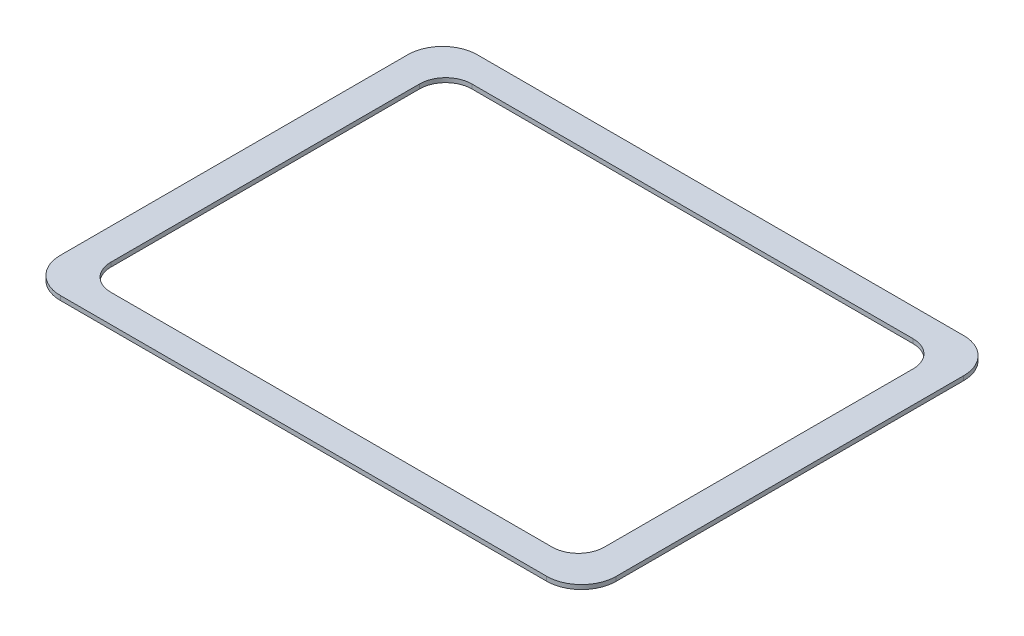
from build123d import *

# Parameters (mm, degrees)
MAINBODY_DEPTH = 1.5875


with BuildPart() as part:
    # Sketch2 → MainBody (new body)
    with BuildSketch(Plane(origin=(0, 49.034568419, 0), x_dir=(1, 0, 0), z_dir=(0, 1, 0))):
        with BuildLine():
            Line((74.712473168, 99.346627483), (-103.087526832, 99.346627483))
            ThreePointArc((-103.087526832, 99.346627483), (-112.067782953, 95.626883604), (-115.787526832, 86.646627483))
            Line((-115.787526832, 86.646627483), (-115.787526832, -40.353372517))
            ThreePointArc((-115.787526832, -40.353372517), (-112.067782953, -49.333628639), (-103.087526832, -53.053372517))
            Line((-103.087526832, -53.053372517), (74.712473168, -53.053372517))
            ThreePointArc((74.712473168, -53.053372517), (83.692729289, -49.333628639), (87.412473168, -40.353372517))
            Line((87.412473168, -40.353372517), (87.412473168, 86.646627483))
            ThreePointArc((87.412473168, 86.646627483), (83.692729289, 95.626883604), (74.712473168, 99.346627483))
        make_face()
        with BuildLine():
            Line((76.007526562, -33.292172517), (76.007526562, 79.585427483))
            ThreePointArc((76.007526562, 79.585427483), (73.218090627, 86.319721548), (66.483796562, 89.109157483))
            Line((66.483796562, 89.109157483), (-94.858850226, 89.109157483))
            ThreePointArc((-94.858850226, 89.109157483), (-101.593144292, 86.319721548), (-104.382580226, 79.585427483))
            Line((-104.382580226, 79.585427483), (-104.382580226, 23.146627483))
            Line((-104.382580226, 23.146627483), (-104.382580226, -33.292172517))
            ThreePointArc((-104.382580226, -33.292172517), (-101.593144292, -40.026466583), (-94.858850226, -42.815902517))
            Line((-94.858850226, -42.815902517), (66.483796562, -42.815902517))
            ThreePointArc((66.483796562, -42.815902517), (73.218090627, -40.026466583), (76.007526562, -33.292172517))
        make_face(mode=Mode.SUBTRACT)
    extrude(amount=MAINBODY_DEPTH)


solid = part.part
